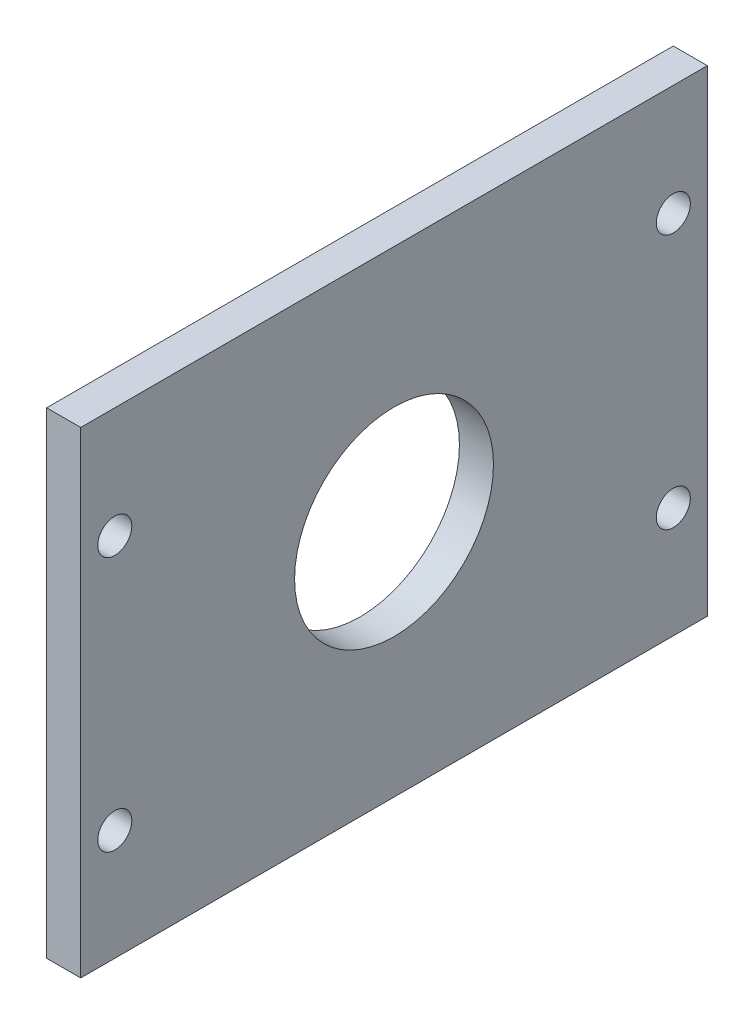
from build123d import *

# Parameters (mm, degrees)
SKETCH1_W               = 92
SKETCH1_H               = 70
SKETCH1_R               = 14.6
BOSS_EXTRUDE1_DEPTH     = 5
CUT_EXTRUDE1_DEPTH      = 116.71084651
CUT_EXTRUDE1_DEPTH_BACK = 116.71084651
SKETCH2_R               = 2.5


with BuildPart() as part:
    # Sketch1 → Boss-Extrude1 (new body)
    with BuildSketch(Plane(origin=(0, 0, 0), x_dir=(0, 0, -1), z_dir=(1, 0, 0))):
        with Locations((46, -35)):
            Rectangle(SKETCH1_W, SKETCH1_H)
        with Locations((46, -35)):
            Circle(SKETCH1_R, mode=Mode.SUBTRACT)
    extrude(amount=BOSS_EXTRUDE1_DEPTH)

    # Sketch2 → Cut-Extrude1 (cut, two sides: drawn at the far end of the back side and taken through both)
    with BuildSketch(Plane(origin=(5, 0, 0), x_dir=(0, 0, -1), z_dir=(1, 0, 0)).offset(-CUT_EXTRUDE1_DEPTH_BACK)):
        with Locations((5, -53.727554141)):
            Circle(SKETCH2_R)
        with Locations((5, -16.272445859)):
            Circle(SKETCH2_R)
        with Locations((87, -53.727554141)):
            Circle(SKETCH2_R)
        with Locations((87, -16.272445859)):
            Circle(SKETCH2_R)
    extrude(amount=CUT_EXTRUDE1_DEPTH + CUT_EXTRUDE1_DEPTH_BACK, mode=Mode.SUBTRACT)


solid = part.part
